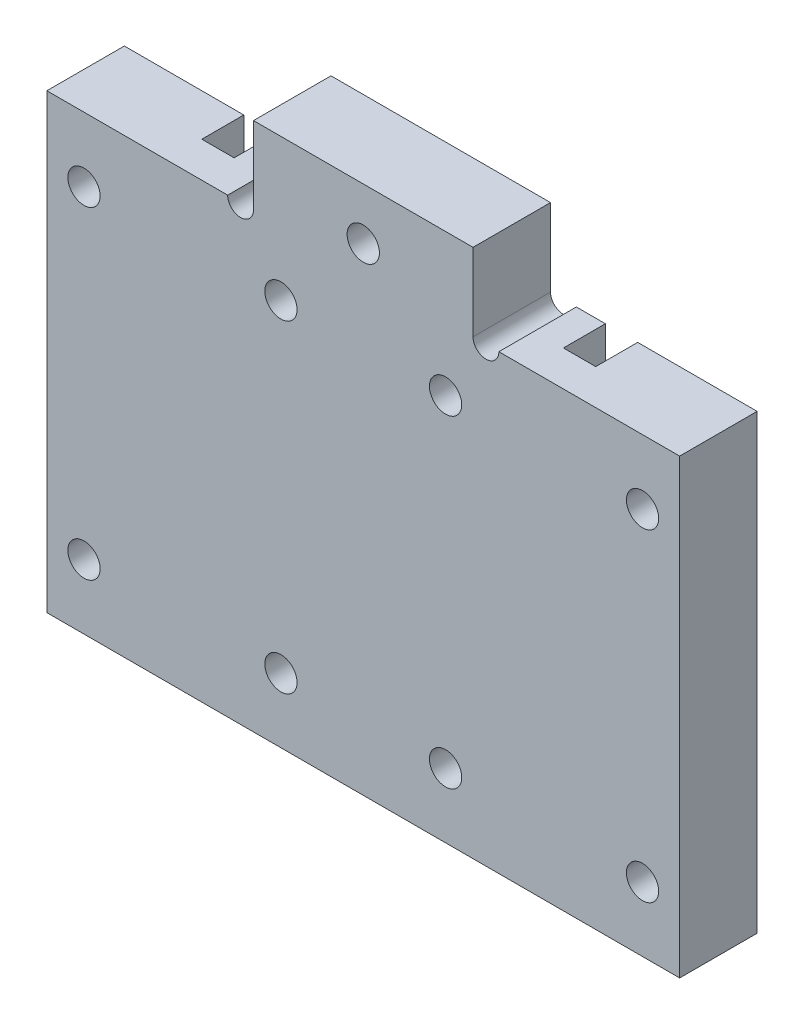
from build123d import *

# Parameters (mm, degrees)
SKETCH1_W                = 98
SKETCH1_H                = 82
BOSS_EXTRUDE1_DEPTH      = 12
CUT_EXTRUDE1_REACH       = 67.008
SKETCH4_W                = 32
SKETCH4_H                = 12
F_5_0_5_DIAMETER_HOLE2_D = 5
F_5_0_5_DIAMETER_HOLE3_D = 5
CUT_EXTRUDE3_DEPTH       = 8
CUT_EXTRUDE4_DEPTH       = 6.5
F_5_0_5_DIAMETER_HOLE1_D = 5
CUT_EXTRUDE2_REACH       = 67.008


# Read off the part's stored shape, not the designer's step: Cut-Extrude3
with BuildPart() as part:
    # Sketch1 → Boss-Extrude1 (new body)
    with BuildSketch(Plane.XY):
        Rectangle(SKETCH1_W, SKETCH1_H)
    extrude(amount=BOSS_EXTRUDE1_DEPTH)

    # Sketch4 → Cut-Extrude1 (cut, up to next)
    with BuildSketch(Plane.XY.offset(12), mode=Mode.PRIVATE) as cut_extrude1_sk1:
        with Locations((-33, 35)):
            Rectangle(SKETCH4_W, SKETCH4_H)
    cut_extrude1_tool1 = extrude(cut_extrude1_sk1.sketch, amount=-CUT_EXTRUDE1_REACH, mode=Mode.PRIVATE) & part.part
    cut_extrude1 = cut_extrude1_tool1.solids().sort_by_distance((-33, 35, 12))[0]
    add(cut_extrude1, mode=Mode.SUBTRACT)

    # Mirror2: Cut-Extrude1 across plane
    add(cut_extrude1.mirror(Plane(origin=(0, 0, 0), x_dir=(0, 0, 1), z_dir=(1, 0, 0))), mode=Mode.SUBTRACT)

    # Ø5.0 (5) Diameter Hole2 (through all)
    with Locations(Plane.XY.offset(12)):
        with Locations((-12.75, 19), (-12.75, -31)):
            f_5_0_5_diameter_hole2 = Hole(F_5_0_5_DIAMETER_HOLE2_D / 2)

    # Ø5.0 (5) Diameter Hole3 (through all)
    with Locations(Plane.XY.offset(12)):
        with Locations((-43.25, 19), (-43.25, -31)):
            f_5_0_5_diameter_hole3 = Hole(F_5_0_5_DIAMETER_HOLE3_D / 2)

    # Cut-Extrude3 outline → Cut-Extrude3 (cut)
    with BuildSketch(Plane.XY):
        with BuildLine():
            ThreePointArc((32, 15), (34, 17), (32, 19))
            Line((32, 19), (24, 19))
            ThreePointArc((24, 19), (22, 17), (24, 15))
            Line((24, 15), (32, 15))
        make_face()
    cut_extrude3 = extrude(amount=CUT_EXTRUDE3_DEPTH, mode=Mode.SUBTRACT)

    # Sketch20 → Cut-Extrude4 (cut)
    with BuildSketch(Plane(origin=(39.292468455, 97.580435701, 0), x_dir=(-1, 0, 0), z_dir=(0, 0, -1))):
        with BuildLine():
            Line((13.792468455, -19.569462754), (13.792468455, -85.580435701))
            ThreePointArc((13.792468455, -85.580435701), (11.292468455, -88.080435701), (8.792468455, -85.580435701))
            Line((8.792468455, -85.580435701), (8.792468455, -19.569462754))
            ThreePointArc((8.792468455, -19.569462754), (11.292468455, -17.069462754), (13.792468455, -19.569462754))
        make_face()
    cut_extrude4 = extrude(amount=-CUT_EXTRUDE4_DEPTH, mode=Mode.SUBTRACT)

    # Mirror1: Ø5.0 (5) Diameter Hole2, Ø5.0 (5) Diameter Hole3, Cut-Extrude3, Cut-Extrude4 across plane
    add(f_5_0_5_diameter_hole2.mirror(Plane(origin=(0, 0, 0), x_dir=(0, 0, 1), z_dir=(1, 0, 0))), mode=Mode.SUBTRACT)
    add(f_5_0_5_diameter_hole3.mirror(Plane(origin=(0, 0, 0), x_dir=(0, 0, 1), z_dir=(1, 0, 0))), mode=Mode.SUBTRACT)
    add(cut_extrude3.mirror(Plane(origin=(0, 0, 0), x_dir=(0, 0, 1), z_dir=(1, 0, 0))), mode=Mode.SUBTRACT)
    add(cut_extrude4.mirror(Plane(origin=(0, 0, 0), x_dir=(0, 0, 1), z_dir=(1, 0, 0))), mode=Mode.SUBTRACT)

    # Ø5.0 (5) Diameter Hole1 (through all)
    with Locations(Plane.XY.offset(12)):
        with Locations((0, 33)):
            Hole(F_5_0_5_DIAMETER_HOLE1_D / 2)

    # Sketch16 → Cut-Extrude2 (cut, up to next)
    with BuildSketch(Plane.XY.offset(12), mode=Mode.PRIVATE) as cut_extrude2_sk1:
        with BuildLine():
            Line((-21, 29), (-17, 29))
            ThreePointArc((-17, 29), (-19, 27), (-21, 29))
        make_face()
    cut_extrude2_tool1 = extrude(cut_extrude2_sk1.sketch, amount=-CUT_EXTRUDE2_REACH, mode=Mode.PRIVATE) & part.part
    # Sketch16 → Cut-Extrude2 (cut, up to next)
    with BuildSketch(Plane.XY.offset(12), mode=Mode.PRIVATE) as cut_extrude2_sk2:
        with BuildLine():
            Line((17, 29), (21, 29))
            ThreePointArc((21, 29), (19, 27), (17, 29))
        make_face()
    cut_extrude2_tool2 = extrude(cut_extrude2_sk2.sketch, amount=-CUT_EXTRUDE2_REACH, mode=Mode.PRIVATE) & part.part
    add(cut_extrude2_tool1.solids().sort_by_distance((-19, 28.151174, 12))[0], mode=Mode.SUBTRACT)
    add(cut_extrude2_tool2.solids().sort_by_distance((19, 28.151174, 12))[0], mode=Mode.SUBTRACT)


solid = part.part
